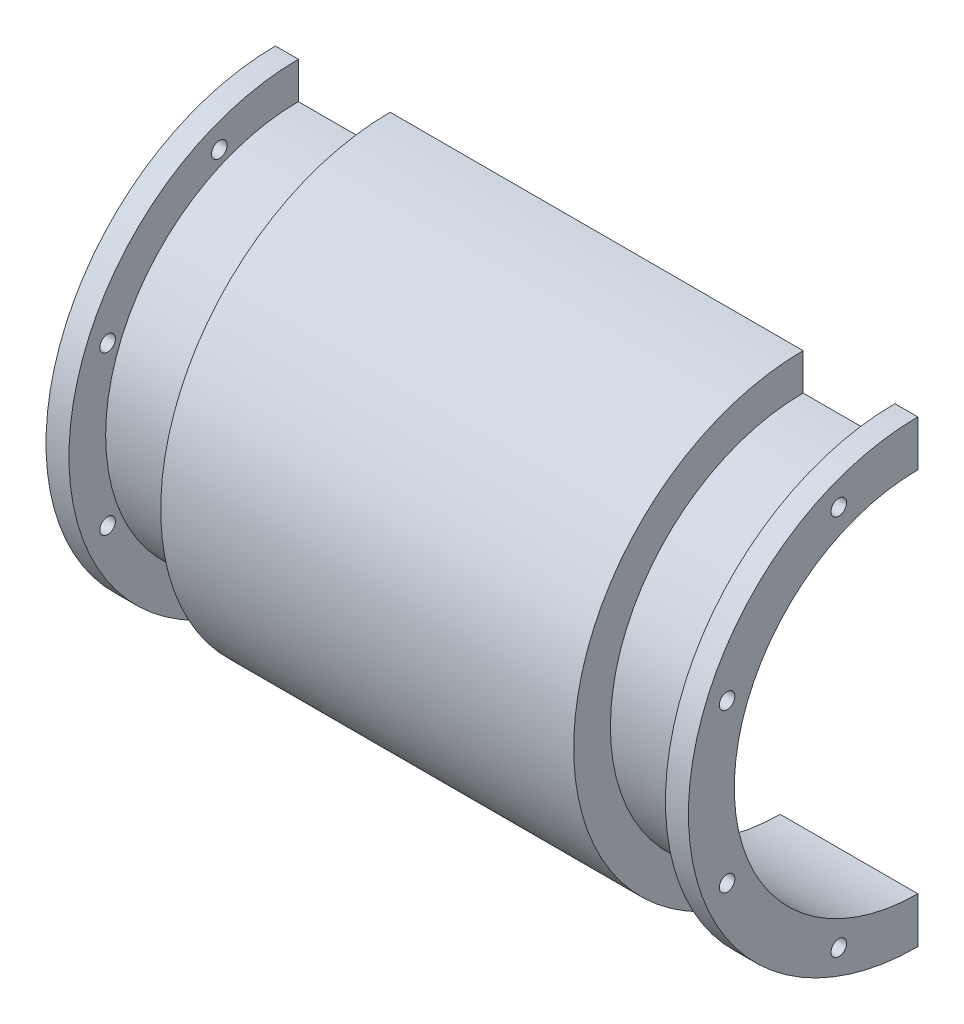
from build123d import *

# Parameters (mm, degrees)
REVOLVE_1_ANGLE          = 180
HOLE_WIZARD_M3_1_D       = 3.4
HOLE_WIZARD_M3_1_DEPTH   = 5
PATTERN_CIRCULAR_1_COUNT = 4
PATTERN_CIRCULAR_1_ANGLE = 135
MIRROR_1_COPY_1_D        = 3.4
MIRROR_1_COPY_1_DEPTH    = 5
MIRROR_1_COPY_2_D        = 3.4
MIRROR_1_COPY_2_DEPTH    = 5
MIRROR_1_COPY_3_D        = 3.4
MIRROR_1_COPY_3_DEPTH    = 5
FILLET_1_R               = 9


with BuildPart() as part:
    # ｽｹｯﾁ1 → 回転1 (revolve)
    with BuildSketch(Plane.XY):
        Polygon((-70, 40), (-40, 40), (-40, 49), (40, 49), (40, 40), (70, 40), (70, 50), (65, 50), (65, 42), (45, 42), (45, 50), (-45, 50), (-45, 42), (-65, 42), (-65, 50), (-70, 50), align=None)
    revolve(axis=Axis((-50, 0, 0), (1, 0, 0)), revolution_arc=REVOLVE_1_ANGLE)

    # M3 すきま穴1
    with Locations(Plane.ZY.offset(70)):
        with Locations((17.220754456, -41.574578963)):
            hole_wizard_m3_1 = Hole(HOLE_WIZARD_M3_1_D / 2, depth=HOLE_WIZARD_M3_1_DEPTH)

    # 円形ﾊﾟﾀｰﾝ1: M3 すきま穴1 ×4 about axis
    pattern_circular_1_axis = Axis((0, 0, 0), (-1, 0, 0))
    for i in range(1, PATTERN_CIRCULAR_1_COUNT):
        add(hole_wizard_m3_1.rotate(pattern_circular_1_axis, i * PATTERN_CIRCULAR_1_ANGLE / (PATTERN_CIRCULAR_1_COUNT - 1)), mode=Mode.SUBTRACT)

    # ﾐﾗｰ1: M3 すきま穴1 across plane
    add(hole_wizard_m3_1.mirror(Plane(origin=(0, 0, 0), x_dir=(0, 0, 1), z_dir=(1, 0, 0))), mode=Mode.SUBTRACT)

    # ﾐﾗｰ1 copy 1
    with Locations(Plane(origin=(70, 0, 0), x_dir=(0, 0.7071067811865487, 0.7071067811865464), z_dir=(1, 0, 0))):
        with Locations((17.220754456, 41.574578963)):
            Hole(MIRROR_1_COPY_1_D / 2, depth=MIRROR_1_COPY_1_DEPTH)

    # ﾐﾗｰ1 copy 2
    with Locations(Plane.YZ.offset(70)):
        with Locations((17.220754456, 41.574578963)):
            Hole(MIRROR_1_COPY_2_D / 2, depth=MIRROR_1_COPY_2_DEPTH)

    # ﾐﾗｰ1 copy 3
    with Locations(Plane(origin=(70, 0, 0), x_dir=(0, 0.7071067811865441, -0.7071067811865509), z_dir=(1, 0, 0))):
        with Locations((17.220754456, 41.574578963)):
            Hole(MIRROR_1_COPY_3_D / 2, depth=MIRROR_1_COPY_3_DEPTH)

    # ﾌｨﾚｯﾄ1
    fillet_1_edges = [part.edges().sort_by_distance(p)[0] for p in [
        (-40, 0, 49),
        (40, 0, 49),
    ]]
    fillet(fillet_1_edges, radius=FILLET_1_R - 0.0001)  # a hair under: the kernel refuses the full size


solid = part.part
